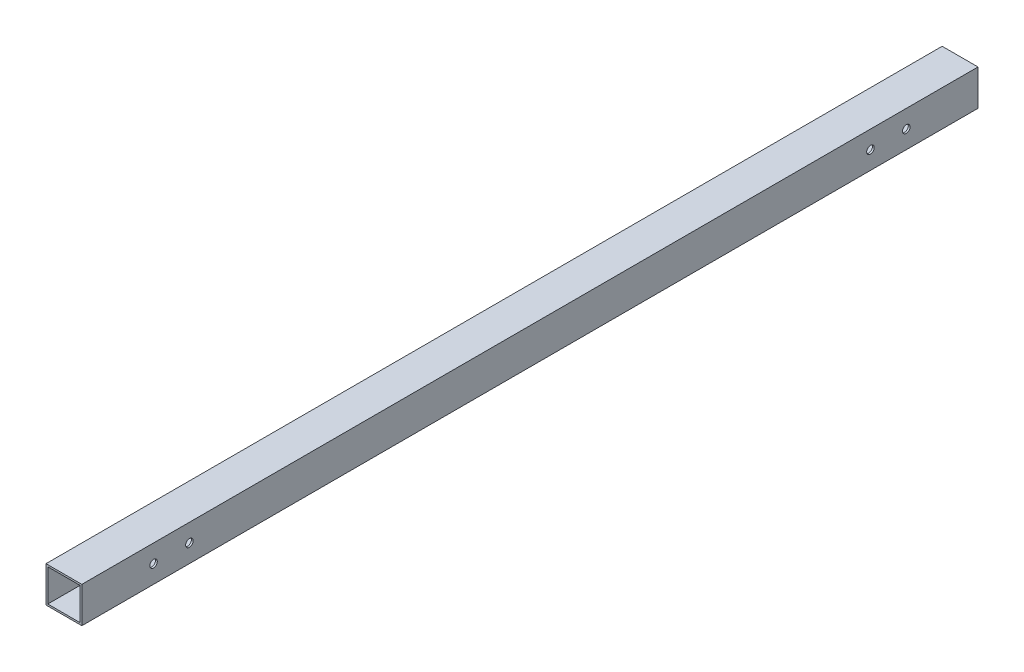
from build123d import *

# Parameters (mm, degrees)
SKETCH_1_W          = 20
SKETCH_1_H          = 20
SKETCH_1_W_2        = 18
SKETCH_1_H_2        = 18
EXTRUDE_1_DEPTH     = 500
SKETCH_2_R          = 2.1
CUT_EXTRUDE_1_DEPTH = 45


with BuildPart() as part:
    # 草图1 → 拉伸-薄壁1 (new body)
    with BuildSketch(Plane.XY):
        with Locations((10, -10)):
            Rectangle(SKETCH_1_W, SKETCH_1_H)
        with Locations((10, -10)):
            Rectangle(SKETCH_1_W_2, SKETCH_1_H_2, mode=Mode.SUBTRACT)
    extrude(amount=EXTRUDE_1_DEPTH)

    # 草图2 → 切除-拉伸1 (cut)
    with BuildSketch(Plane(origin=(20, 0, 0), x_dir=(0, 0, -1), z_dir=(1, 0, 0))):
        with Locations((-460, -10)):
            Circle(SKETCH_2_R)
        with Locations((-440, -10)):
            Circle(SKETCH_2_R)
        with Locations((-60, -10)):
            Circle(SKETCH_2_R)
        with Locations((-40, -10)):
            Circle(SKETCH_2_R)
    extrude(amount=-CUT_EXTRUDE_1_DEPTH, mode=Mode.SUBTRACT)


solid = part.part
